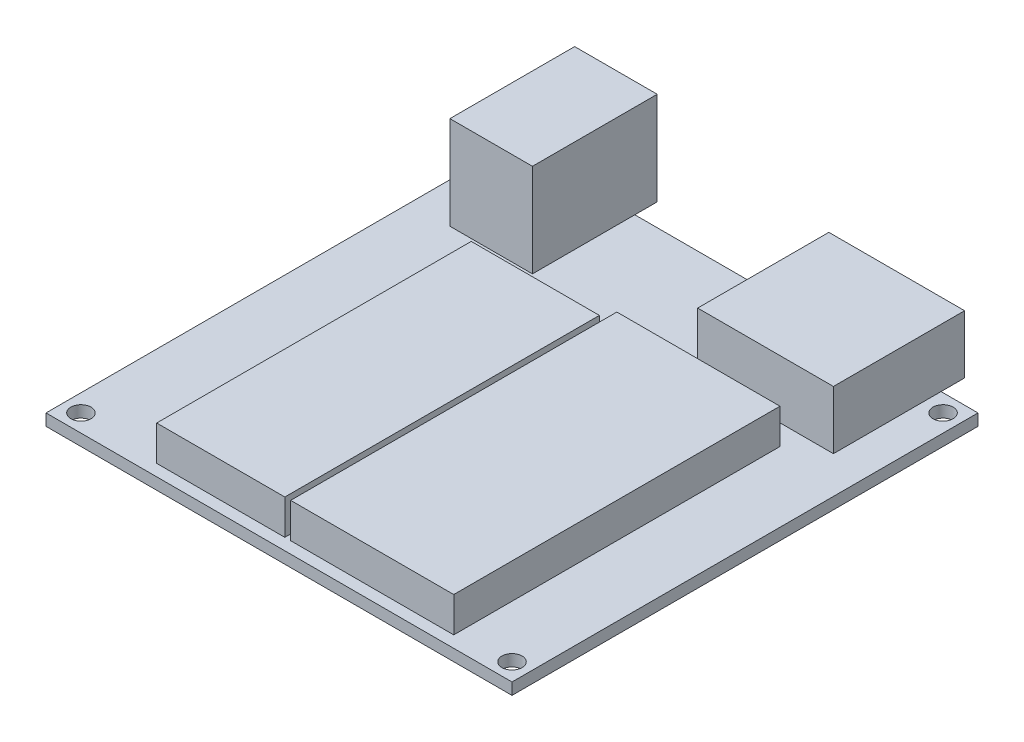
from build123d import *

# Parameters (mm, degrees)
SKETCH3_W           = 50.8
SKETCH3_H           = 50.8
BOSS_EXTRUDE1_DEPTH = 1.27
CUT_EXTRUDE1_REACH  = 73.853
SKETCH4_R           = 1.0999978
SKETCH5_W           = 17.78
SKETCH5_H           = 35.56
SKETCH5_W_2         = 13.97
SKETCH5_H_2         = 34.29
BOSS_EXTRUDE2_DEPTH = 3.81
SKETCH6_W           = 14.8000212
SKETCH6_H           = 14.2999968
BOSS_EXTRUDE3_DEPTH = 6.35
BOSS_EXTRUDE4_DEPTH = 10.16


with BuildPart() as part:
    # Sketch3 → Boss-Extrude1 (new body)
    with BuildSketch(Plane(origin=(0, 0, 0), x_dir=(1, 0, 0), z_dir=(0, 1, 0))):
        with Locations((25.4, 25.4)):
            Rectangle(SKETCH3_W, SKETCH3_H)
    extrude(amount=BOSS_EXTRUDE1_DEPTH)

    # Sketch4 → Cut-Extrude1 (cut, up to next)
    with BuildSketch(Plane(origin=(0, 0, 0), x_dir=(1, 0, 0), z_dir=(0, 1, 0)), mode=Mode.PRIVATE) as cut_extrude1_sk1:
        with Locations((1.905, 48.895)):
            Circle(SKETCH4_R)
    cut_extrude1_tool1 = extrude(cut_extrude1_sk1.sketch, amount=CUT_EXTRUDE1_REACH, mode=Mode.PRIVATE) & part.part
    # Sketch4 → Cut-Extrude1 (cut, up to next)
    with BuildSketch(Plane(origin=(0, 0, 0), x_dir=(1, 0, 0), z_dir=(0, 1, 0)), mode=Mode.PRIVATE) as cut_extrude1_sk2:
        with Locations((48.895, 48.895)):
            Circle(SKETCH4_R)
    cut_extrude1_tool2 = extrude(cut_extrude1_sk2.sketch, amount=CUT_EXTRUDE1_REACH, mode=Mode.PRIVATE) & part.part
    # Sketch4 → Cut-Extrude1 (cut, up to next)
    with BuildSketch(Plane(origin=(0, 0, 0), x_dir=(1, 0, 0), z_dir=(0, 1, 0)), mode=Mode.PRIVATE) as cut_extrude1_sk3:
        with Locations((48.895, 1.905)):
            Circle(SKETCH4_R)
    cut_extrude1_tool3 = extrude(cut_extrude1_sk3.sketch, amount=CUT_EXTRUDE1_REACH, mode=Mode.PRIVATE) & part.part
    # Sketch4 → Cut-Extrude1 (cut, up to next)
    with BuildSketch(Plane(origin=(0, 0, 0), x_dir=(1, 0, 0), z_dir=(0, 1, 0)), mode=Mode.PRIVATE) as cut_extrude1_sk4:
        with Locations((1.905, 1.905)):
            Circle(SKETCH4_R)
    cut_extrude1_tool4 = extrude(cut_extrude1_sk4.sketch, amount=CUT_EXTRUDE1_REACH, mode=Mode.PRIVATE) & part.part
    add(cut_extrude1_tool1.solids().sort_by_distance((1.905, 0, -48.895))[0], mode=Mode.SUBTRACT)
    add(cut_extrude1_tool2.solids().sort_by_distance((48.895, 0, -48.895))[0], mode=Mode.SUBTRACT)
    add(cut_extrude1_tool3.solids().sort_by_distance((48.895, 0, -1.905))[0], mode=Mode.SUBTRACT)
    add(cut_extrude1_tool4.solids().sort_by_distance((1.905, 0, -1.905))[0], mode=Mode.SUBTRACT)

    # Sketch5 → Boss-Extrude2 (add)
    with BuildSketch(Plane(origin=(0, 1.27, 0), x_dir=(1, 0, 0), z_dir=(0, 1, 0))):
        with Locations((34.29, 19.05)):
            Rectangle(SKETCH5_W, SKETCH5_H)
        with Locations((17.78, 18.415)):
            Rectangle(SKETCH5_W_2, SKETCH5_H_2)
    extrude(amount=BOSS_EXTRUDE2_DEPTH)

    # Sketch6 → Boss-Extrude3 (add)
    with BuildSketch(Plane(origin=(0, 1.27, 0), x_dir=(1, 0, 0), z_dir=(0, 1, 0))):
        with Locations((39.37, 46.219999)):
            Rectangle(SKETCH6_W, SKETCH6_H)
    extrude(amount=BOSS_EXTRUDE3_DEPTH)

    # Sketch7 → Boss-Extrude4 (add)
    with BuildSketch(Plane(origin=(0, 1.27, 0), x_dir=(1, 0, 0), z_dir=(0, 1, 0))):
        Polygon((4.390009, 53.2400002), (13.389991, 53.2400002), (13.389991, 50.340006), (13.389991, 39.640002), (4.390009, 39.640002), align=None)
    extrude(amount=BOSS_EXTRUDE4_DEPTH)


solid = part.part
